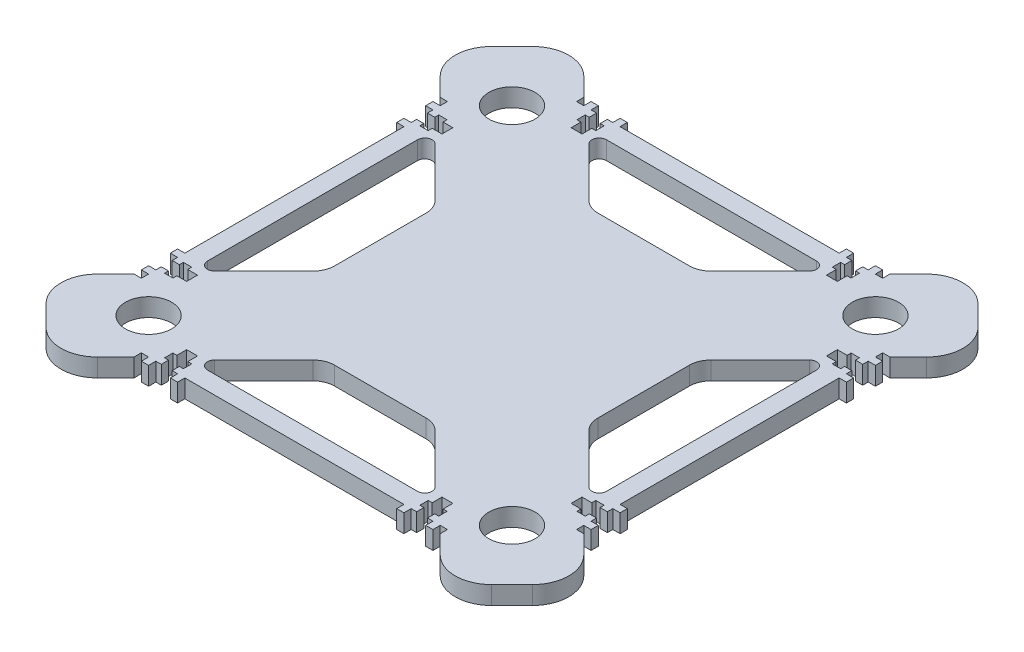
from build123d import *
from OCP.BRepAlgoAPI import BRepAlgoAPI_Cut
from OCP.TopTools import TopTools_ListOfShape

# Parameters (mm, degrees)
SKETCH1_W           = 120
SKETCH1_H           = 120
BOSS_EXTRUDE1_DEPTH = 5
BOSS_EXTRUDE3_DEPTH = 5
SKETCH3_R           = 6.375
CUT_EXTRUDE1_DEPTH  = 5
CUT_EXTRUDE3_DEPTH  = 5
CUT_EXTRUDE4_DEPTH  = 10
FILLET1_R           = 10
CUT_EXTRUDE5_DEPTH  = 10
FILLET2_R           = 2
FILLET3_R           = 6
CUT_EXTRUDE6_DEPTH  = 10
SKETCH9_W           = 2
SKETCH9_H           = 2
BOSS_EXTRUDE4_DEPTH = 5


with BuildPart() as part:
    # Sketch1 → Boss-Extrude1 (new body)
    with BuildSketch(Plane(origin=(0, 0, 0), x_dir=(1, 0, 0), z_dir=(0, 1, 0))):
        with Locations((60, 60)):
            Rectangle(SKETCH1_W, SKETCH1_H)
    extrude(amount=BOSS_EXTRUDE1_DEPTH)

    # Sketch2 → Boss-Extrude3 (add)
    with BuildSketch(Plane(origin=(0, 5, 0), x_dir=(1, 0, 0), z_dir=(0, 1, 0))):
        Polygon((100.201009868, 120), (120, 100.201010386), (134.142135439, 114.343146195), (114.343145306, 134.142135809), align=None)
        Polygon((0, 100.201010386), (-14.142135439, 114.343146195), (5.656854694, 134.142135809), (19.798990132, 120), align=None)
        Polygon((19.798990132, 0), (0, 19.798989614), (-14.142135439, 5.656853805), (5.656854694, -14.142135809), align=None)
        Polygon((120, 19.798989614), (134.142135439, 5.656853805), (114.343145306, -14.142135809), (100.201009868, 0), align=None)
    extrude(amount=-BOSS_EXTRUDE3_DEPTH)

    # Sketch3 → Cut-Extrude1 (cut)
    with BuildSketch(Plane(origin=(0, 5, 0), x_dir=(1, 0, 0), z_dir=(0, 1, 0))):
        with Locations((9.899495066, 9.899494807)):
            Circle(SKETCH3_R)
        with Locations((110.100504934, 9.899494807)):
            Circle(SKETCH3_R)
        with Locations((9.899495066, 110.100505193)):
            Circle(SKETCH3_R)
        with Locations((110.100504934, 110.100505193)):
            Circle(SKETCH3_R)
    extrude(amount=-CUT_EXTRUDE1_DEPTH, mode=Mode.SUBTRACT)

    # Sketch5 → Cut-Extrude3 (cut)
    with BuildSketch(Plane(origin=(0, 5, 0), x_dir=(1, 0, 0), z_dir=(0, 1, 0))):
        Polygon((65, 15), (60, 10), (55, 15), (60, 5), align=None)
    extrude(amount=-CUT_EXTRUDE3_DEPTH, mode=Mode.SUBTRACT)


with BuildPart() as cut_extrude4_tool:
    # Sketch6 → Cut-Extrude4 (new body)
    with BuildSketch(Plane(origin=(0, 5, 0), x_dir=(1, 0, 0), z_dir=(0, 1, 0))):
        Polygon((0, 19.798989614), (0, 17.798989562), (-2, 17.798989562), align=None)
        Polygon((17.798989572, -1.99999991), (19.798989614, 1e-07), (17.798989562, 9e-08), align=None)
        Polygon((100.201010386, 1e-07), (102.201010438, 9e-08), (102.201010428, -1.99999991), align=None)
        Polygon((122, 17.798989562), (120, 19.798989614), (120, 17.798989562), align=None)
        Polygon((120, 100.201010386), (120, 102.201010438), (122, 102.201010438), align=None)
        Polygon((102.201010428, 121.99999991), (100.201010386, 119.9999999), (102.201010438, 119.99999991), align=None)
        Polygon((19.798989614, 119.9999999), (17.798989562, 119.99999991), (17.798989572, 121.99999991), align=None)
        Polygon((-2, 102.201010438), (0, 100.201010386), (0, 102.201010438), align=None)
    extrude(amount=-CUT_EXTRUDE4_DEPTH)


with BuildPart() as part_1:
    add(part.part)

    # Cut-Extrude4: cut by cut_extrude4_tool, with a tolerance
    cut_extrude4_stock = TopTools_ListOfShape()
    cut_extrude4_stock.Append(part_1.part.wrapped)
    cut_extrude4_tools = TopTools_ListOfShape()
    cut_extrude4_tools.Append(cut_extrude4_tool.part.wrapped)
    cut_extrude4_cut = BRepAlgoAPI_Cut()
    cut_extrude4_cut.SetArguments(cut_extrude4_stock)
    cut_extrude4_cut.SetTools(cut_extrude4_tools)
    cut_extrude4_cut.SetFuzzyValue(0.00001)
    cut_extrude4_cut.Build()
    add(Compound.cast(cut_extrude4_cut.Shape()).solids(), mode=Mode.REPLACE)

    # Fillet1
    fillet1_edges = [part_1.edges().sort_by_distance(p)[0] for p in [
        (5.656854694, 2.5, 14.142135809),
        (-14.142135439, 2.5, -5.656853805),
        (-14.142135439, 2.5, -114.343146195),
        (5.656854694, 2.5, -134.142135809),
        (114.343145306, 2.5, -134.142135809),
        (134.142135439, 2.5, -114.343146195),
        (134.142135439, 2.5, -5.656853805),
        (114.343145306, 2.5, 14.142135809),
    ]]
    fillet(fillet1_edges, radius=FILLET1_R)

    # Sketch7 → Cut-Extrude5 (cut)
    with BuildSketch(Plane(origin=(0, 5, 0), x_dir=(1, 0, 0), z_dir=(0, 1, 0))):
        Polygon((23.695149054, 44.908350765), (23.695149054, 75.091649235), (5, 93.786798778), (5, 26.213201222), align=None)
        Polygon((96.304850946, 44.908350765), (115, 26.213201222), (115, 93.786798778), (96.304850946, 75.091649235), align=None)
        Polygon((75.091646979, 96.304851884), (93.786795359, 115.0000021), (26.213197803, 114.9999979), (44.908348508, 96.304850008), align=None)
        Polygon((44.908353021, 23.695148116), (26.213204641, 4.9999979), (93.786802197, 5.0000021), (75.091651492, 23.695149992), align=None)
    extrude(amount=-CUT_EXTRUDE5_DEPTH, mode=Mode.SUBTRACT)

    # Fillet2
    fillet2_edges = [part_1.edges().sort_by_distance(p)[0] for p in [
        (115, 2.5, -26.213201222),
        (115, 2.5, -93.786798778),
        (93.786795359, 2.5, -115.0000021),
        (26.213197803, 2.5, -114.9999979),
        (26.213204641, 2.5, -4.9999979),
        (93.786802197, 2.5, -5.0000021),
        (5, 2.5, -26.213201222),
        (5, 2.5, -93.786798778),
    ]]
    fillet(fillet2_edges, radius=FILLET2_R)

    # Fillet3
    fillet3_edges = [part_1.edges().sort_by_distance(p)[0] for p in [
        (44.908348508, 2.5, -96.304850008),
        (75.091646979, 2.5, -96.304851884),
        (23.695149054, 2.5, -75.091649235),
        (23.695149054, 2.5, -44.908350765),
        (75.091651492, 2.5, -23.695149992),
        (44.908353021, 2.5, -23.695148116),
        (96.304850946, 2.5, -44.908350765),
        (96.304850946, 2.5, -75.091649235),
    ]]
    fillet(fillet3_edges, radius=FILLET3_R)


with BuildPart() as cut_extrude6_tool:
    # Sketch8 → Cut-Extrude6 (new body)
    with BuildSketch(Plane(origin=(0, 5, 0), x_dir=(1, 0, 0), z_dir=(0, 1, 0))):
        Polygon((23.298989562, 2), (23.298989562, 0), (26.298989562, 0), (26.298989562, 2), (27.398989562, 2), (27.398989562, 4.3), (26.298989562, 4.3), (26.298989562, 7), (23.298989562, 7), (23.298989562, 4.3), (22.198989562, 4.3), (22.198989562, 2), align=None)
        Polygon((93.701010438, 2), (93.701010438, 0), (96.701010438, 0), (96.701010438, 2), (97.801010438, 2), (97.801010438, 4.3), (96.701010438, 4.3), (96.701010438, 7), (93.701010438, 7), (93.701010438, 4.3), (92.601010438, 4.3), (92.601010438, 2), align=None)
        Polygon((96.701010438, 118), (96.701010438, 120), (93.701010438, 120), (93.701010438, 118), (92.601010438, 118), (92.601010438, 115.7), (93.701010438, 115.7), (93.701010438, 113), (96.701010438, 113), (96.701010438, 115.7), (97.801010438, 115.7), (97.801010438, 118), align=None)
        Polygon((26.298989562, 118), (26.298989562, 120), (23.298989562, 120), (23.298989562, 118), (22.198989562, 118), (22.198989562, 115.7), (23.298989562, 115.7), (23.298989562, 113), (26.298989562, 113), (26.298989562, 115.7), (27.398989562, 115.7), (27.398989562, 118), align=None)
        Polygon((2.000002013, 96.701013008), (2.013e-06, 96.701013061), (1.934e-06, 93.701013061), (2.000001934, 93.701013008), (2.000001905, 92.601013008), (4.300001905, 92.601012948), (4.300001934, 93.701012948), (7.000001934, 93.701012877), (7.000002013, 96.701012877), (4.300002013, 96.701012948), (4.300002041, 97.801012948), (2.000002041, 97.801013008), align=None)
        Polygon((2.00000017, 26.298992132), (1.7e-07, 26.298992184), (9.2e-08, 23.298992184), (2.000000092, 23.298992132), (2.000000063, 22.198992132), (4.300000063, 22.198992072), (4.300000092, 23.298992072), (7.000000092, 23.298992001), (7.00000017, 26.298992001), (4.30000017, 26.298992072), (4.300000199, 27.398992072), (2.000000199, 27.398992132), align=None)
        Polygon((118.000000092, 23.298989096), (120.000000092, 23.298989044), (120.00000017, 26.298989044), (118.00000017, 26.298989096), (118.000000199, 27.398989096), (115.700000199, 27.398989156), (115.70000017, 26.298989156), (113.00000017, 26.298989227), (113.000000092, 23.298989227), (115.700000092, 23.298989156), (115.700000063, 22.198989156), (118.000000063, 22.198989096), align=None)
        Polygon((118.000001934, 93.701009972), (120.000001934, 93.70100992), (120.000002013, 96.70100992), (118.000002013, 96.701009972), (118.000002041, 97.801009972), (115.700002041, 97.801010033), (115.700002013, 96.701010033), (113.000002013, 96.701010103), (113.000001934, 93.701010103), (115.700001934, 93.701010033), (115.700001905, 92.601010033), (118.000001905, 92.601009972), align=None)
    extrude(amount=-CUT_EXTRUDE6_DEPTH)


with BuildPart() as part_2:
    add(part_1.part)

    # Cut-Extrude6: cut by cut_extrude6_tool, with a tolerance
    cut_extrude6_stock = TopTools_ListOfShape()
    cut_extrude6_stock.Append(part_2.part.wrapped)
    cut_extrude6_tools = TopTools_ListOfShape()
    cut_extrude6_tools.Append(cut_extrude6_tool.part.wrapped)
    cut_extrude6_cut = BRepAlgoAPI_Cut()
    cut_extrude6_cut.SetArguments(cut_extrude6_stock)
    cut_extrude6_cut.SetTools(cut_extrude6_tools)
    cut_extrude6_cut.SetFuzzyValue(0.00001)
    cut_extrude6_cut.Build()
    add(Compound.cast(cut_extrude6_cut.Shape()).solids(), mode=Mode.REPLACE)


with BuildPart() as boss_extrude4_tool:
    # Sketch9 → Boss-Extrude4 (new body)
    with BuildSketch(Plane(origin=(0, 5, 0), x_dir=(1, 0, 0), z_dir=(0, 1, 0))):
        with Locations((-0.999998536, 99.201012877)):
            Rectangle(SKETCH9_W, SKETCH9_H)
        with Locations((-0.999998536, 91.201012877)):
            Rectangle(SKETCH9_W, SKETCH9_H)
        Polygon((19.798989745, 120.000000641), (19.798989797, 122.000000641), (21.798989797, 122.000000588), (21.798989745, 120.000000588), align=None)
        Polygon((27.798989745, 120.000000431), (29.798989745, 120.000000379), (29.798989797, 122.000000379), (27.798989797, 122.000000431), align=None)
        Polygon((92.201010255, 120.000000431), (92.201010203, 122.000000431), (90.201010203, 122.000000379), (90.201010255, 120.000000379), align=None)
        Polygon((98.201010255, 120.000000588), (100.201010255, 120.000000641), (100.201010203, 122.000000641), (98.201010203, 122.000000588), align=None)
        with Locations((120.999998536, 99.201012877)):
            Rectangle(SKETCH9_W, SKETCH9_H)
        with Locations((120.999998536, 91.201012877)):
            Rectangle(SKETCH9_W, SKETCH9_H)
        with Locations((120.999998536, 28.798986086)):
            Rectangle(SKETCH9_W, SKETCH9_H)
        with Locations((120.999998536, 20.798986086)):
            Rectangle(SKETCH9_W, SKETCH9_H)
        Polygon((98.201010255, -1.625e-06), (98.201010203, -2.000001625), (100.201010203, -2.000001677), (100.201010255, -1.677e-06), align=None)
        Polygon((92.201010255, -1.467e-06), (90.201010255, -1.415e-06), (90.201010203, -2.000001415), (92.201010203, -2.000001467), align=None)
        Polygon((27.798989745, -1.467e-06), (27.798989797, -2.000001467), (29.798989797, -2.000001415), (29.798989745, -1.415e-06), align=None)
        Polygon((21.798989745, -1.625e-06), (19.798989745, -1.677e-06), (19.798989797, -2.000001677), (21.798989797, -2.000001625), align=None)
        with Locations((-0.999998536, 20.798986086)):
            Rectangle(SKETCH9_W, SKETCH9_H)
        with Locations((-0.999998536, 28.798986086)):
            Rectangle(SKETCH9_W, SKETCH9_H)
    extrude(amount=-BOSS_EXTRUDE4_DEPTH)


with BuildPart() as part_3:
    add(part_2.part)


with BuildPart() as part_4:
    # Boss-Extrude4: joined with boss_extrude4_tool
    add(part_3.part.fuse(boss_extrude4_tool.part, tol=0.00001))


solid = part_4.part
